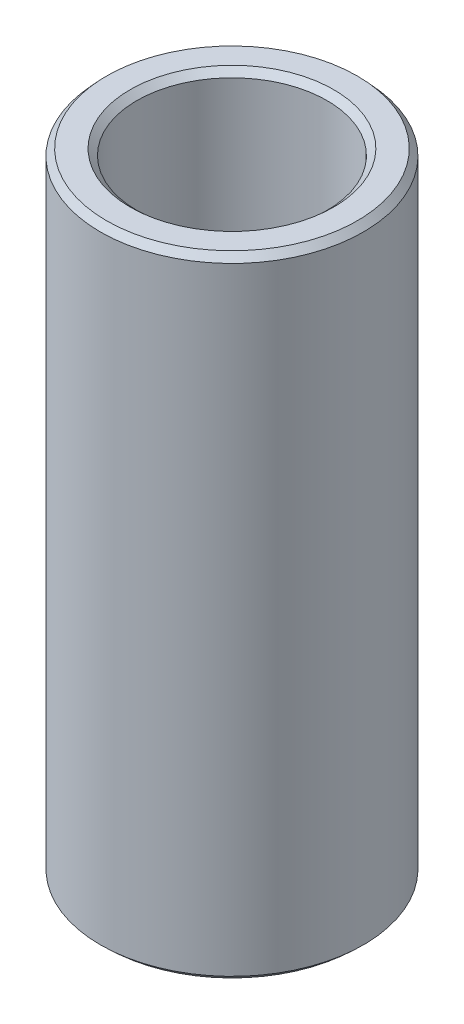
from build123d import *
from OCP.BRepFilletAPI import BRepFilletAPI_MakeChamfer

# Parameters (mm, degrees)
SKETCH1_R           = 50
BOSS_EXTRUDE1_DEPTH = 239.547411143
SKETCH2_R           = 36.158649303
CUT_EXTRUDE1_DEPTH  = 250.765814685
CHAMFER1_SIZE       = 2.534371786
CHAMFER1_SIZE2      = 2.330972191


with BuildPart() as part:
    # Sketch1 → Boss-Extrude1 (new body)
    with BuildSketch(Plane(origin=(0, 0, 0), x_dir=(1, 0, 0), z_dir=(0, 1, 0))):
        Circle(SKETCH1_R)
    extrude(amount=BOSS_EXTRUDE1_DEPTH)

    # Sketch2 → Cut-Extrude1 (cut, through all)
    with BuildSketch(Plane(origin=(0, 0, 0), x_dir=(1, 0, 0), z_dir=(0, 1, 0))):
        Circle(SKETCH2_R)
    extrude(amount=CUT_EXTRUDE1_DEPTH, mode=Mode.SUBTRACT)

    # Chamfer1: one chamfer whose edges measure the first distance from different faces: ONE call of the kernel's chamfer builder (chamfer() names one face for all edges)
    chamfer1_edges_1 = [part.edges().sort_by_distance(p)[0] for p in [
        (-36.158649303, 239.547411143, 0),
    ]]
    chamfer1_side_1 = [part.faces().sort_by_distance(p)[0] for p in [
        (-48.585786438, 239.547411143, 0),
    ]]
    chamfer1_edges_2 = [part.edges().sort_by_distance(p)[0] for p in [
        (-36.158649303, 0, 0),
    ]]
    chamfer1_side_2 = [part.faces().sort_by_distance(p)[0] for p in [
        (-36.158649303, 119.773705572, 0),
    ]]
    chamfer1_edges_3 = [part.edges().sort_by_distance(p)[0] for p in [
        (-50, 0, 0),
    ]]
    chamfer1_side_3 = [part.faces().sort_by_distance(p)[0] for p in [
        (-48.585786438, 0, 0),
    ]]
    chamfer1_edges_4 = [part.edges().sort_by_distance(p)[0] for p in [
        (-50, 239.547411143, 0),
    ]]
    chamfer1_side_4 = [part.faces().sort_by_distance(p)[0] for p in [
        (-50, 119.773705572, 0),
    ]]
    chamfer1 = BRepFilletAPI_MakeChamfer(part.part.solid().wrapped)
    for e in chamfer1_edges_1:
        chamfer1.Add(CHAMFER1_SIZE, CHAMFER1_SIZE2, e.wrapped, chamfer1_side_1[0].wrapped)  # the first distance lies on this face
    for e in chamfer1_edges_2:
        chamfer1.Add(CHAMFER1_SIZE, CHAMFER1_SIZE2, e.wrapped, chamfer1_side_2[0].wrapped)  # the first distance lies on this face
    for e in chamfer1_edges_3:
        chamfer1.Add(CHAMFER1_SIZE, CHAMFER1_SIZE2, e.wrapped, chamfer1_side_3[0].wrapped)  # the first distance lies on this face
    for e in chamfer1_edges_4:
        chamfer1.Add(CHAMFER1_SIZE, CHAMFER1_SIZE2, e.wrapped, chamfer1_side_4[0].wrapped)  # the first distance lies on this face
    add(Compound.cast(chamfer1.Shape()), mode=Mode.REPLACE)


solid = part.part
